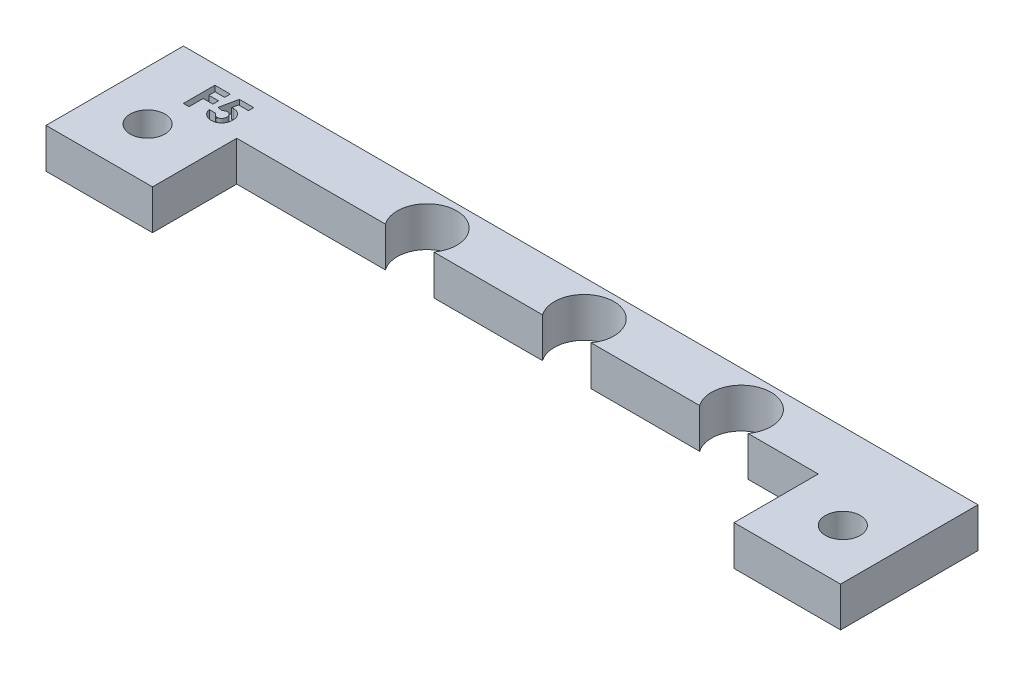
from build123d import *

# Parameters (mm, degrees)
BOSS_EXTRUDE1_OUTLINE_R = 1.75
BOSS_EXTRUDE1_DEPTH     = 4
CUT_EXTRUDE1_DEPTH      = 1


# Read off the part's stored shape, not the designer's step: Boss-Extrude1
with BuildPart() as part:
    # Boss-Extrude1 outline → Boss-Extrude1 (new body)
    with BuildSketch(Plane(origin=(0, 0, 0), x_dir=(1, 0, 0), z_dir=(0, 1, 0))):
        with BuildLine():
            Line((24.976474615, -10.33744254), (35.92307775, -10.33744254))
            ThreePointArc((35.92307775, -10.33744254), (38.359776182, -5.587442326), (40.796474615, -10.33744254))
            Line((40.796474615, -10.33744254), (47.859776182, -10.33744254))
            Line((47.859776182, -10.33744254), (47.859776182, -18.81631662))
            Line((47.859776182, -18.81631662), (58.584776182, -18.81631662))
            Line((58.584776182, -18.81631662), (58.584776182, -4.977921711))
            Line((58.584776182, -4.977921711), (-21.415223818, -4.977921711))
            Line((-21.415223818, -4.977921711), (-21.415223818, -18.81631662))
            Line((-21.415223818, -18.81631662), (-10.690223818, -18.81631662))
            Line((-10.690223818, -18.81631662), (-10.690223818, -10.33744254))
            Line((-10.690223818, -10.33744254), (4.28307775, -10.33744254))
            ThreePointArc((4.28307775, -10.33744254), (6.719776183, -5.587442326), (9.156474615, -10.33744254))
            Line((9.156474615, -10.33744254), (20.10307775, -10.33744254))
            ThreePointArc((20.10307775, -10.33744254), (22.539776182, -5.587442326), (24.976474615, -10.33744254))
        make_face()
        with Locations((-16.415223818, -13.587442433)):
            Circle(BOSS_EXTRUDE1_OUTLINE_R, mode=Mode.SUBTRACT)
        with Locations((53.584776182, -13.587442433)):
            Circle(BOSS_EXTRUDE1_OUTLINE_R, mode=Mode.SUBTRACT)
    extrude(amount=BOSS_EXTRUDE1_DEPTH)

    # Sketch2 → Cut-Extrude1 (cut)
    with BuildSketch(Plane(origin=(0, 4, 0), x_dir=(1, 0, 0), z_dir=(0, 1, 0))):
        Polygon((-16.41198232, -6.812466594), (-14.865187448, -6.812466594), (-14.865187448, -7.382338389), (-15.842110525, -7.382338389), (-15.842110525, -7.992915312), (-14.865187448, -7.992915312), (-14.865187448, -8.562787107), (-15.842110525, -8.562787107), (-15.842110525, -9.987466594), (-16.41198232, -9.987466594), align=None)
        with BuildLine():
            Line((-13.949958082, -6.812466594), (-12.504290013, -6.812466594))
            Line((-12.504290013, -6.812466594), (-12.504290013, -7.341633261))
            Line((-12.504290013, -7.341633261), (-13.498385565, -7.341633261))
            Line((-13.498385565, -7.341633261), (-13.622409003, -7.942033902))
            add(Edge.make_bspline(
                [(-13.622409003, -7.942033902), (-13.605509034, -7.937327047), (-13.572178824, -7.928044162), (-13.52196682, -7.918734604), (-13.473304391, -7.912700444), (-13.441372402, -7.911895568), (-13.425879556, -7.911505055)],
                knots=[0, 0, 0, 0, 1.05461699, 2.079921384, 3.068411212, 4, 4, 4, 4], degree=3))
            add(Edge.make_bspline(
                [(-13.425879556, -7.911505055), (-13.392119021, -7.912278658), (-13.325569569, -7.913803601), (-13.228216166, -7.928280275), (-13.134994532, -7.951080599), (-13.046189934, -7.983598566), (-12.961889124, -8.025921539), (-12.881989912, -8.077120472), (-12.806394235, -8.137285289), (-12.73644499, -8.20645366), (-12.672172703, -8.282402096), (-12.616291615, -8.364548366), (-12.568565678, -8.451721144), (-12.530606118, -8.544462294), (-12.500645197, -8.642189339), (-12.478994766, -8.744964906), (-12.466191785, -8.852910799), (-12.464465382, -8.926554564), (-12.463584884, -8.96411423)],
                knots=[0, 0, 0, 0, 1.01440847, 1.999622559, 2.951875003, 3.895578053, 4.836219714, 5.782137149, 6.743708247, 7.735272588, 8.734977101, 9.730283169, 10.717124674, 11.717316708, 12.737475749, 13.78628267, 14.87096371, 16, 16, 16, 16], degree=3))
            add(Edge.make_bspline(
                [(-12.463584884, -8.96411423), (-12.464660866, -9.002100285), (-12.466784093, -9.077057875), (-12.480636202, -9.187272048), (-12.505085424, -9.292832343), (-12.538668877, -9.394021345), (-12.582912926, -9.490095338), (-12.63612245, -9.582049577), (-12.699197079, -9.669201514), (-12.771517834, -9.750657738), (-12.850139982, -9.82511029), (-12.93385401, -9.890606342), (-13.022071802, -9.94572074), (-13.114795487, -9.990262491), (-13.211493079, -10.025503132), (-13.312193927, -10.051156636), (-13.417387424, -10.065867495), (-13.488800141, -10.067862709), (-13.525098306, -10.06887685)],
                knots=[0, 0, 0, 0, 1.06808661, 2.107647099, 3.116961351, 4.110378221, 5.100014249, 6.085620622, 7.093190682, 8.119403071, 9.144090782, 10.133780668, 11.103064255, 12.062861538, 13.020824475, 13.992378307, 14.979551724, 16, 16, 16, 16], degree=3))
            add(Edge.make_bspline(
                [(-13.525098306, -10.06887685), (-13.557558674, -10.068047219), (-13.621577314, -10.066411014), (-13.715873961, -10.056354031), (-13.806786399, -10.038573192), (-13.893831984, -10.012839713), (-13.97792658, -9.981167676), (-14.058098031, -9.941555807), (-14.134786891, -9.894758372), (-14.207775393, -9.841629423), (-14.275877579, -9.781781722), (-14.338034038, -9.716268103), (-14.394621073, -9.645914331), (-14.444427811, -9.569852456), (-14.487298122, -9.488194854), (-14.525316388, -9.40190388), (-14.556434719, -9.310078379), (-14.572226377, -9.24641984), (-14.580251551, -9.214069158)],
                knots=[0, 0, 0, 0, 1.054957082, 2.080596141, 3.077793124, 4.061112343, 5.027190972, 5.994718051, 6.962465889, 7.943658696, 8.924948258, 9.904494768, 10.875059, 11.855380583, 12.854004648, 13.869083016, 14.917087635, 16, 16, 16, 16], degree=3))
            Line((-14.580251551, -9.214069158), (-13.9289695, -9.214069158))
            add(Edge.make_bspline(
                [(-13.9289695, -9.214069158), (-13.917064048, -9.236486864), (-13.893927162, -9.280053116), (-13.849915688, -9.337893862), (-13.800647638, -9.387217966), (-13.746567435, -9.428507334), (-13.687324675, -9.459440626), (-13.625333386, -9.482899003), (-13.559814799, -9.496454731), (-13.515193749, -9.498149331), (-13.492661407, -9.499005055)],
                knots=[0, 0, 0, 0, 1.104910296, 2.147267069, 3.153527244, 4.136738762, 5.099945312, 6.05603338, 7.018353, 8, 8, 8, 8], degree=3))
            add(Edge.make_bspline(
                [(-13.492661407, -9.499005055), (-13.476956667, -9.49841417), (-13.446057326, -9.497251594), (-13.400532034, -9.491101274), (-13.357076143, -9.479452707), (-13.315366568, -9.463322149), (-13.275291268, -9.443205522), (-13.237424734, -9.417809591), (-13.201108159, -9.388577933), (-13.166894426, -9.355034506), (-13.135906647, -9.317641387), (-13.108733754, -9.277459932), (-13.08443744, -9.235382981), (-13.066440789, -9.189743761), (-13.051703054, -9.141905074), (-13.040849589, -9.09150606), (-13.03436342, -9.038487855), (-13.033762974, -9.002293813), (-13.033456679, -8.983830777)],
                knots=[0, 0, 0, 0, 0.978869489, 1.925942215, 2.855067702, 3.774946051, 4.70828698, 5.642468714, 6.60995405, 7.609372294, 8.622401667, 9.629904756, 10.629323, 11.642352373, 12.678539694, 13.745912462, 14.850161547, 16, 16, 16, 16], degree=3))
            add(Edge.make_bspline(
                [(-13.033456679, -8.983830777), (-13.03381217, -8.965796309), (-13.034504141, -8.930691779), (-13.040228266, -8.879145756), (-13.050468615, -8.830237908), (-13.064421178, -8.783593638), (-13.082282125, -8.739496193), (-13.104109396, -8.697683084), (-13.129996239, -8.65836566), (-13.160081636, -8.622344386), (-13.192164393, -8.589304649), (-13.226631584, -8.560408358), (-13.263172677, -8.536426443), (-13.300652202, -8.515489534), (-13.340566208, -8.500252107), (-13.382017188, -8.489758654), (-13.424961552, -8.48205898), (-13.454252971, -8.481606596), (-13.469128755, -8.48137685)],
                knots=[0, 0, 0, 0, 1.166249705, 2.270133367, 3.348514167, 4.393962215, 5.415026464, 6.420877785, 7.440098956, 8.453121383, 9.451844239, 10.415694839, 11.355045125, 12.27538808, 13.187007209, 14.108269027, 15.039275622, 16, 16, 16, 16], degree=3))
            add(Edge.make_bspline(
                [(-13.469128755, -8.48137685), (-13.485287313, -8.481989978), (-13.51767253, -8.483218817), (-13.565788856, -8.493217552), (-13.613325034, -8.509399257), (-13.660545412, -8.531724482), (-13.706981248, -8.560941158), (-13.753858004, -8.59520897), (-13.799606617, -8.637017798), (-13.828694857, -8.668157109), (-13.843743138, -8.684266474)],
                knots=[0, 0, 0, 0, 0.88288272, 1.769486374, 2.674910571, 3.623812639, 4.617874466, 5.670434592, 6.794841017, 8, 8, 8, 8], degree=3))
            Line((-13.843743138, -8.684266474), (-14.323300429, -8.574235424))
            Line((-14.323300429, -8.574235424), (-13.949958082, -6.812466594))
        make_face()
    extrude(amount=-CUT_EXTRUDE1_DEPTH, mode=Mode.SUBTRACT)


solid = part.part
